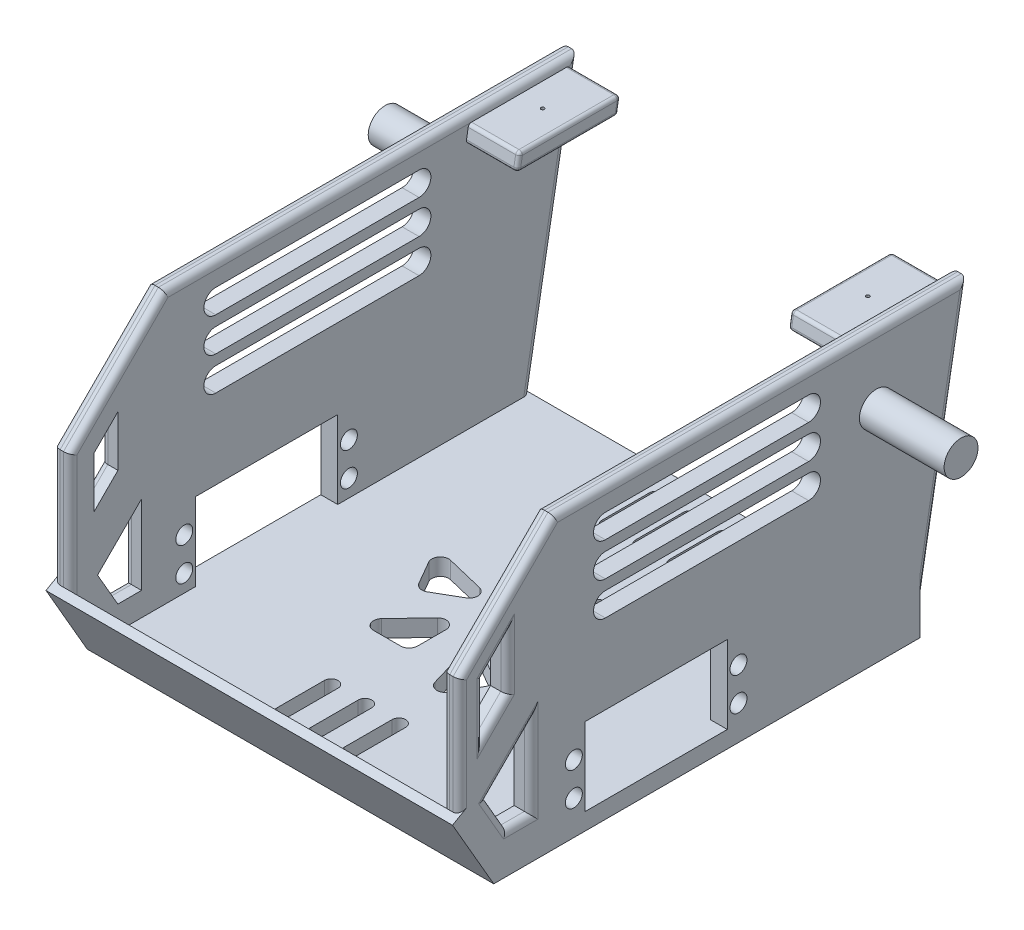
from build123d import *

# Parameters (mm, degrees)
SKETCH6_W           = 120
SKETCH6_H           = 125.893841544
BOSS_EXTRUDE1_DEPTH = 5
BOSS_EXTRUDE2_START = 60
BOSS_EXTRUDE2_DEPTH = 5
BOSS_EXTRUDE3_START = -55
BOSS_EXTRUDE3_DEPTH = 5
SKETCH9_W           = 120
SKETCH9_H           = 24.330127019
BOSS_EXTRUDE5_DEPTH = 2.5
CUT_EXTRUDE1_REACH  = 165.515
SKETCH10_R          = 2.5
SKETCH10_W          = 42
SKETCH10_H          = 20
SKETCH10_H_2        = 3
FILLET1_R           = 2
SKETCH11_R          = 5
BOSS_EXTRUDE6_DEPTH = 25
BOSS_EXTRUDE7_START = -145
SKETCH11_3_R        = 5
BOSS_EXTRUDE7_DEPTH = 25
BOSS_EXTRUDE8_DEPTH = 15
BOSS_EXTRUDE9_START = 110
BOSS_EXTRUDE9_DEPTH = 15
FILLET3_R           = 1
FILLET4_R           = 1
SKETCH13_R          = 0.5
CUT_EXTRUDE2_DEPTH  = 10


with BuildPart() as part:
    # Sketch6 → Boss-Extrude1 (new body)
    with BuildSketch(Plane(origin=(0, 0, 0), x_dir=(1, 0, 0), z_dir=(0, 1, 0))):
        Rectangle(SKETCH6_W, SKETCH6_H)
        with BuildLine():
            Line((7.031840361, 18.39292277), (7.031840361, 10))
            ThreePointArc((7.031840361, 10), (8.602875139, 7.679003745), (11.341459254, 8.275100159))
            Line((11.341459254, 8.275100159), (19.341459254, 16.668022929))
            ThreePointArc((19.341459254, 16.668022929), (19.82991016, 19.377237353), (17.531840361, 20.89292277))
            Line((17.531840361, 20.89292277), (9.531840361, 20.89292277))
            ThreePointArc((9.531840361, 20.89292277), (7.764073408, 20.160689723), (7.031840361, 18.39292277))
        make_face(mode=Mode.SUBTRACT)
        with BuildLine():
            Line((22.859722058, 2.191645487), (26.859722058, -4.736557743))
            ThreePointArc((26.859722058, -4.736557743), (26.696134883, -7.484587277), (24.105660914, -8.416183596))
            Line((24.105660914, -8.416183596), (12.837176584, -5.684441751))
            ThreePointArc((12.837176584, -5.684441751), (10.951649888, -3.610806544), (12.176174218, -1.089752388))
            Line((12.176174218, -1.089752388), (19.444658549, 3.106708997))
            ThreePointArc((19.444658549, 3.106708997), (21.341706161, 3.356460053), (22.859722058, 2.191645487))
        make_face(mode=Mode.SUBTRACT)
        with BuildLine():
            Line((13.327881697, -18.701277282), (9.327881697, -25.629480512))
            ThreePointArc((9.327881697, -25.629480512), (6.866224723, -26.86182463), (4.76420166, -25.084206525))
            Line((4.76420166, -25.084206525), (1.49571733, -13.95954191))
            ThreePointArc((1.49571733, -13.95954191), (2.348774749, -11.289810288), (5.144333857, -11.089752388))
            Line((5.144333857, -11.089752388), (12.412818188, -15.286213773))
            ThreePointArc((12.412818188, -15.286213773), (13.577632754, -16.804229669), (13.327881697, -18.701277282))
        make_face(mode=Mode.SUBTRACT)
        with BuildLine():
            Line((-9.531840361, -20.89292277), (-17.531840361, -20.89292277))
            ThreePointArc((-17.531840361, -20.89292277), (-19.82991016, -19.377237353), (-19.341459254, -16.668022929))
            Line((-19.341459254, -16.668022929), (-11.341459254, -8.275100159))
            ThreePointArc((-11.341459254, -8.275100159), (-8.602875139, -7.679003745), (-7.031840361, -10))
            Line((-7.031840361, -10), (-7.031840361, -18.39292277))
            ThreePointArc((-7.031840361, -18.39292277), (-7.764073408, -20.160689723), (-9.531840361, -20.89292277))
        make_face(mode=Mode.SUBTRACT)
        with BuildLine():
            Line((-22.859722058, -2.191645487), (-26.859722058, 4.736557743))
            ThreePointArc((-26.859722058, 4.736557743), (-26.696134883, 7.484587277), (-24.105660914, 8.416183596))
            Line((-24.105660914, 8.416183596), (-12.837176584, 5.684441751))
            ThreePointArc((-12.837176584, 5.684441751), (-10.951649888, 3.610806544), (-12.176174218, 1.089752388))
            Line((-12.176174218, 1.089752388), (-19.444658549, -3.106708997))
            ThreePointArc((-19.444658549, -3.106708997), (-21.341706161, -3.356460053), (-22.859722058, -2.191645487))
        make_face(mode=Mode.SUBTRACT)
        with BuildLine():
            Line((-13.327881697, 18.701277282), (-9.327881697, 25.629480512))
            ThreePointArc((-9.327881697, 25.629480512), (-6.866224723, 26.86182463), (-4.76420166, 25.084206525))
            Line((-4.76420166, 25.084206525), (-1.49571733, 13.95954191))
            ThreePointArc((-1.49571733, 13.95954191), (-2.348774749, 11.289810288), (-5.144333857, 11.089752388))
            Line((-5.144333857, 11.089752388), (-12.412818188, 15.286213773))
            ThreePointArc((-12.412818188, 15.286213773), (-13.577632754, 16.804229669), (-13.327881697, 18.701277282))
        make_face(mode=Mode.SUBTRACT)
        with BuildLine():
            Line((-2, 40.946920772), (-2, 54.946920772))
            ThreePointArc((-2, 54.946920772), (0, 56.946920772), (2, 54.946920772))
            Line((2, 54.946920772), (2, 40.946920772))
            ThreePointArc((2, 40.946920772), (0, 38.946920772), (-2, 40.946920772))
        make_face(mode=Mode.SUBTRACT)
        with BuildLine():
            Line((12, 40.946920772), (12, 54.946920772))
            ThreePointArc((12, 54.946920772), (10, 56.946920772), (8, 54.946920772))
            Line((8, 54.946920772), (8, 40.946920772))
            ThreePointArc((8, 40.946920772), (10, 38.946920772), (12, 40.946920772))
        make_face(mode=Mode.SUBTRACT)
        with BuildLine():
            Line((-12, 40.946920772), (-12, 54.946920772))
            ThreePointArc((-12, 54.946920772), (-10, 56.946920772), (-8, 54.946920772))
            Line((-8, 54.946920772), (-8, 40.946920772))
            ThreePointArc((-8, 40.946920772), (-10, 38.946920772), (-12, 40.946920772))
        make_face(mode=Mode.SUBTRACT)
        with BuildLine():
            Line((-2, -40.946920772), (-2, -54.946920772))
            ThreePointArc((-2, -54.946920772), (0, -56.946920772), (2, -54.946920772))
            Line((2, -54.946920772), (2, -40.946920772))
            ThreePointArc((2, -40.946920772), (0, -38.946920772), (-2, -40.946920772))
        make_face(mode=Mode.SUBTRACT)
        with BuildLine():
            Line((8, -40.946920772), (8, -54.946920772))
            ThreePointArc((8, -54.946920772), (10, -56.946920772), (12, -54.946920772))
            Line((12, -54.946920772), (12, -40.946920772))
            ThreePointArc((12, -40.946920772), (10, -38.946920772), (8, -40.946920772))
        make_face(mode=Mode.SUBTRACT)
        with BuildLine():
            Line((-12, -40.946920772), (-12, -54.946920772))
            ThreePointArc((-12, -54.946920772), (-10, -56.946920772), (-8, -54.946920772))
            Line((-8, -54.946920772), (-8, -40.946920772))
            ThreePointArc((-8, -40.946920772), (-10, -38.946920772), (-12, -40.946920772))
        make_face(mode=Mode.SUBTRACT)
    extrude(amount=-BOSS_EXTRUDE1_DEPTH)

    # Sketch1 → Boss-Extrude2 (add)
    with BuildSketch(Plane(origin=(0, 0, 0), x_dir=(0, 0, -1), z_dir=(1, 0, 0)).offset(BOSS_EXTRUDE2_START)):
        Polygon((-72.946920772, 52), (-44.946920772, 80), (77.053079228, 80), (62.946920772, 0), (-62.946920772, 0), (-72.946920772, 17.320508076), align=None)
        with BuildLine():
            Line((30, 66.5), (-30, 66.5))
            ThreePointArc((-30, 66.5), (-33.5, 70), (-30, 73.5))
            Line((-30, 73.5), (30, 73.5))
            ThreePointArc((30, 73.5), (33.5, 70), (30, 66.5))
        make_face(mode=Mode.SUBTRACT)
        with BuildLine():
            Line((30, 56.5), (-30, 56.5))
            ThreePointArc((-30, 56.5), (-33.5, 60), (-30, 63.5))
            Line((-30, 63.5), (30, 63.5))
            ThreePointArc((30, 63.5), (33.5, 60), (30, 56.5))
        make_face(mode=Mode.SUBTRACT)
        with BuildLine():
            Line((30, 46.5), (-30, 46.5))
            ThreePointArc((-30, 46.5), (-33.5, 50), (-30, 53.5))
            Line((-30, 53.5), (30, 53.5))
            ThreePointArc((30, 53.5), (33.5, 50), (30, 46.5))
        make_face(mode=Mode.SUBTRACT)
        Polygon((-58.87585296, 56.171572875), (-65.946920772, 49.100505063), (-65.946920772, 34.100505063), (-58.87585296, 41.171572875), align=None, mode=Mode.SUBTRACT)
        Polygon((-64.905468887, 17.392304845), (-58.905468887, 7), (-51.905468887, 7), (-51.905468887, 30.392304845), align=None, mode=Mode.SUBTRACT)
    extrude(amount=-BOSS_EXTRUDE2_DEPTH)

    # Sketch1<2> → Boss-Extrude3 (add)
    with BuildSketch(Plane(origin=(0, 0, 0), x_dir=(0, 0, -1), z_dir=(1, 0, 0)).offset(BOSS_EXTRUDE3_START)):
        Polygon((-72.946920772, 52), (-44.946920772, 80), (77.053079228, 80), (62.946920772, 0), (-62.946920772, 0), (-72.946920772, 17.320508076), align=None)
        with BuildLine():
            Line((30, 66.5), (-30, 66.5))
            ThreePointArc((-30, 66.5), (-33.5, 70), (-30, 73.5))
            Line((-30, 73.5), (30, 73.5))
            ThreePointArc((30, 73.5), (33.5, 70), (30, 66.5))
        make_face(mode=Mode.SUBTRACT)
        with BuildLine():
            Line((30, 56.5), (-30, 56.5))
            ThreePointArc((-30, 56.5), (-33.5, 60), (-30, 63.5))
            Line((-30, 63.5), (30, 63.5))
            ThreePointArc((30, 63.5), (33.5, 60), (30, 56.5))
        make_face(mode=Mode.SUBTRACT)
        with BuildLine():
            Line((30, 46.5), (-30, 46.5))
            ThreePointArc((-30, 46.5), (-33.5, 50), (-30, 53.5))
            Line((-30, 53.5), (30, 53.5))
            ThreePointArc((30, 53.5), (33.5, 50), (30, 46.5))
        make_face(mode=Mode.SUBTRACT)
        Polygon((-58.87585296, 56.171572875), (-65.946920772, 49.100505063), (-65.946920772, 34.100505063), (-58.87585296, 41.171572875), align=None, mode=Mode.SUBTRACT)
        Polygon((-64.905468887, 17.392304845), (-58.905468887, 7), (-51.905468887, 7), (-51.905468887, 30.392304845), align=None, mode=Mode.SUBTRACT)
    extrude(amount=-BOSS_EXTRUDE3_DEPTH)

    # Sketch9 → Boss-Extrude5 (add)
    with BuildSketch(Plane(origin=(0, -27.256816239, 47.210190579), x_dir=(1, 0, 0), z_dir=(0, -0.4999999999999971, 0.8660254037844403))):
        with Locations((0, 39.308396877)):
            Rectangle(SKETCH9_W, SKETCH9_H)
    extrude(amount=BOSS_EXTRUDE5_DEPTH)

    # Cut-Extrude1: up to this face of the body (flat: up to its plane)
    cut_extrude1_end = Plane(part.part.faces().sort_by_distance((60, 34.60628694, -2.836274331))[0])
    # Sketch10 → Cut-Extrude1 (cut, up to the picked face)
    with BuildSketch(Plane.ZY.offset(60), mode=Mode.PRIVATE) as cut_extrude1_sk1:
        with Locations((-9.3, 14.9)):
            Circle(SKETCH10_R)
    cut_extrude1_tool1 = split(extrude(cut_extrude1_sk1.sketch, amount=-CUT_EXTRUDE1_REACH, mode=Mode.PRIVATE), bisect_by=cut_extrude1_end, keep=Keep.BOTH, mode=Mode.PRIVATE)
    # Sketch10 → Cut-Extrude1 (cut, up to the picked face)
    with BuildSketch(Plane.ZY.offset(60), mode=Mode.PRIVATE) as cut_extrude1_sk2:
        with Locations((-9.3, 5.1)):
            Circle(SKETCH10_R)
    cut_extrude1_tool2 = split(extrude(cut_extrude1_sk2.sketch, amount=-CUT_EXTRUDE1_REACH, mode=Mode.PRIVATE), bisect_by=cut_extrude1_end, keep=Keep.BOTH, mode=Mode.PRIVATE)
    # Sketch10 → Cut-Extrude1 (cut, up to the picked face)
    with BuildSketch(Plane.ZY.offset(60), mode=Mode.PRIVATE) as cut_extrude1_sk3:
        with Locations((15, 10)):
            Rectangle(SKETCH10_W, SKETCH10_H)
    cut_extrude1_tool3 = split(extrude(cut_extrude1_sk3.sketch, amount=-CUT_EXTRUDE1_REACH, mode=Mode.PRIVATE), bisect_by=cut_extrude1_end, keep=Keep.BOTH, mode=Mode.PRIVATE)
    # Sketch10 → Cut-Extrude1 (cut, up to the picked face)
    with BuildSketch(Plane.ZY.offset(60), mode=Mode.PRIVATE) as cut_extrude1_sk4:
        with Locations((15, 21.5)):
            Rectangle(SKETCH10_W, SKETCH10_H_2)
    cut_extrude1_tool4 = split(extrude(cut_extrude1_sk4.sketch, amount=-CUT_EXTRUDE1_REACH, mode=Mode.PRIVATE), bisect_by=cut_extrude1_end, keep=Keep.BOTH, mode=Mode.PRIVATE)
    # Sketch10 → Cut-Extrude1 (cut, up to the picked face)
    with BuildSketch(Plane.ZY.offset(60), mode=Mode.PRIVATE) as cut_extrude1_sk5:
        with Locations((39.3, 14.9)):
            Circle(SKETCH10_R)
    cut_extrude1_tool5 = split(extrude(cut_extrude1_sk5.sketch, amount=-CUT_EXTRUDE1_REACH, mode=Mode.PRIVATE), bisect_by=cut_extrude1_end, keep=Keep.BOTH, mode=Mode.PRIVATE)
    # Sketch10 → Cut-Extrude1 (cut, up to the picked face)
    with BuildSketch(Plane.ZY.offset(60), mode=Mode.PRIVATE) as cut_extrude1_sk6:
        with Locations((39.3, 5.1)):
            Circle(SKETCH10_R)
    cut_extrude1_tool6 = split(extrude(cut_extrude1_sk6.sketch, amount=-CUT_EXTRUDE1_REACH, mode=Mode.PRIVATE), bisect_by=cut_extrude1_end, keep=Keep.BOTH, mode=Mode.PRIVATE)
    add(cut_extrude1_tool1.solids().sort_by(Axis((-60, 14.9, -9.3), (1, 0, 0)))[0], mode=Mode.SUBTRACT)
    add(cut_extrude1_tool2.solids().sort_by(Axis((-60, 5.1, -9.3), (1, 0, 0)))[0], mode=Mode.SUBTRACT)
    add(cut_extrude1_tool3.solids().sort_by(Axis((-60, 10, 15), (1, 0, 0)))[0], mode=Mode.SUBTRACT)
    add(cut_extrude1_tool4.solids().sort_by(Axis((-60, 21.5, 15), (1, 0, 0)))[0], mode=Mode.SUBTRACT)
    add(cut_extrude1_tool5.solids().sort_by(Axis((-60, 14.9, 39.3), (1, 0, 0)))[0], mode=Mode.SUBTRACT)
    add(cut_extrude1_tool6.solids().sort_by(Axis((-60, 5.1, 39.3), (1, 0, 0)))[0], mode=Mode.SUBTRACT)

    # Fillet1
    fillet1_edges = [part.edges().sort_by_distance(p)[0] for p in [
        (55, 34.660254038, 72.946920772),
        (55, 66, 58.946920772),
        (55, 80, -16.053079228),
        (55, 40, -70),
        (60, 12.196152423, 61.905468887),
        (60, 23.892304845, 58.405468887),
        (60, 18.696152423, 51.905468887),
        (60, 7, 55.405468887),
        (60, 48.671572875, 58.87585296),
        (60, 37.636038969, 62.411386866),
        (60, 41.600505063, 65.946920772),
        (60, 52.636038969, 62.411386866),
        (60, 34.660254038, 72.946920772),
        (60, 66, 58.946920772),
        (60, 80, -16.053079228),
        (60, 40, -70),
        (-55, 34.660254038, 72.946920772),
        (-55, 40, -70),
        (-55, 80, -16.053079228),
        (-55, 66, 58.946920772),
        (-60, 34.660254038, 72.946920772),
        (-60, 66, 58.946920772),
        (-60, 80, -16.053079228),
        (-60, 40, -70),
        (-60, 12.196152423, 61.905468887),
        (-60, 7, 55.405468887),
        (-60, 18.696152423, 51.905468887),
        (-60, 23.892304845, 58.405468887),
        (-60, 48.671572875, 58.87585296),
        (-60, 52.636038969, 62.411386866),
        (-60, 41.600505063, 65.946920772),
        (-60, 37.636038969, 62.411386866),
    ]]
    fillet(fillet1_edges, radius=FILLET1_R)

    # Sketch11 → Boss-Extrude6 (add)
    with BuildSketch(Plane(origin=(60, 0, 0), x_dir=(0, 0, -1), z_dir=(1, 0, 0))):
        with Locations((50, 60)):
            Circle(SKETCH11_R)
    extrude(amount=BOSS_EXTRUDE6_DEPTH)

    # Sketch11<3> → Boss-Extrude7 (add)
    with BuildSketch(Plane(origin=(60, 0, 0), x_dir=(0, 0, -1), z_dir=(1, 0, 0)).offset(BOSS_EXTRUDE7_START)):
        with Locations((50, 60)):
            Circle(SKETCH11_3_R)
    extrude(amount=BOSS_EXTRUDE7_DEPTH)

    # Sketch12 → Boss-Extrude8 (add)
    with BuildSketch(Plane(origin=(-55, 0, 0), x_dir=(0, 0, -1), z_dir=(1, 0, 0))):
        Polygon((74.669572043, 78), (44.669572043, 78), (43.801331155, 73.075961235), (73.801331155, 73.075961235), align=None)
    extrude(amount=BOSS_EXTRUDE8_DEPTH)

    # Sketch12<2> → Boss-Extrude9 (add)
    with BuildSketch(Plane(origin=(-55, 0, 0), x_dir=(0, 0, -1), z_dir=(1, 0, 0)).offset(BOSS_EXTRUDE9_START)):
        Polygon((74.669572043, 78), (44.669572043, 78), (43.801331155, 73.075961235), (73.801331155, 73.075961235), align=None)
    extrude(amount=-BOSS_EXTRUDE9_DEPTH)

    # Fillet3
    # the kernel refuses this fillet: 1 mm, written as the material it takes off along each edge
    with BuildSketch(Plane(origin=(41, 74.075961235, -44.993084747), x_dir=(0, -1, 0), z_dir=(-1, 0, 0))) as fillet3_piece_1_section:
        Polygon((0, 0), (FILLET3_R * 1.02, 0), (FILLET3_R * 1.02, FILLET3_R * 1.21558866445), (-FILLET3_R * 0.17712114122, FILLET3_R * 1.00450390807), align=None)
    fillet3_piece_1 = extrude(amount=FILLET3_R * 1.02, mode=Mode.PRIVATE)
    fillet3_piece_1 = fillet3_piece_1 - Plane(origin=(41, 74.075961235, -44.993084747), x_dir=(0, 0.6427876096865395, -0.7660444431189778), z_dir=(-1, 0, 0)) * Sphere(FILLET3_R, mode=Mode.PRIVATE)
    add(fillet3_piece_1, mode=Mode.SUBTRACT)
    with BuildSketch(Plane(origin=(41, 74.075961235, -72.962231524), x_dir=(0, -1, 0), z_dir=(-1, 0, 0))) as fillet3_piece_2_section:
        Polygon((0, 0), (FILLET3_R * 1.02, 0), (FILLET3_R * 1.02, -FILLET3_R * 0.855881623801), (FILLET3_R * 0.17712114122, -FILLET3_R * 1.00450390807), align=None)
    fillet3_piece_2 = extrude(amount=FILLET3_R * 1.02, mode=Mode.PRIVATE)
    fillet3_piece_2 = fillet3_piece_2 - Plane(origin=(41, 74.075961235, -72.962231524), x_dir=(0, 0.766044443118978, 0.6427876096865394), z_dir=(-1, 0, 0)) * Sphere(FILLET3_R, mode=Mode.PRIVATE)
    add(fillet3_piece_2, mode=Mode.SUBTRACT)
    with BuildSketch(Plane(origin=(41, 77, -45.508671674), x_dir=(0, 0.17364817766693028, 0.9848077530122081), z_dir=(-1, 0, 0))) as fillet3_piece_3_section:
        Polygon((0, 0), (FILLET3_R * 1.02, 0), (FILLET3_R * 1.02, FILLET3_R * 0.855881623801), (FILLET3_R * 0.17712114122, FILLET3_R * 1.00450390807), align=None)
    fillet3_piece_3 = extrude(amount=FILLET3_R * 1.02, mode=Mode.PRIVATE)
    fillet3_piece_3 = fillet3_piece_3 - Plane(origin=(41, 77, -45.508671674), x_dir=(0, -0.766044443118978, -0.6427876096865394), z_dir=(-1, 0, 0)) * Sphere(FILLET3_R, mode=Mode.PRIVATE)
    add(fillet3_piece_3, mode=Mode.SUBTRACT)
    with BuildSketch(Plane(origin=(41, 77, -73.477818451), x_dir=(0, -0.17364817766693075, -0.984807753012208), z_dir=(-1, 0, 0))) as fillet3_piece_4_section:
        Polygon((0, 0), (FILLET3_R * 1.02, 0), (FILLET3_R * 1.02, -FILLET3_R * 1.21558866445), (-FILLET3_R * 0.17712114122, -FILLET3_R * 1.00450390807), align=None)
    fillet3_piece_4 = extrude(amount=FILLET3_R * 1.02, mode=Mode.PRIVATE)
    fillet3_piece_4 = fillet3_piece_4 - Plane(origin=(41, 77, -73.477818451), x_dir=(0, -0.6427876096865393, 0.7660444431189782), z_dir=(-1, 0, 0)) * Sphere(FILLET3_R, mode=Mode.PRIVATE)
    add(fillet3_piece_4, mode=Mode.SUBTRACT)
    with BuildSketch(Plane(origin=(40, 73.075961235, -44.993084747), x_dir=(1, 0, 0), z_dir=(0, 0, -1)), Plane(origin=(40, 78, -73.477818451), x_dir=(1, 0, 0), z_dir=(0, 0, 1))) as fillet3_piece_5:
        with BuildLine():
            CenterArc((FILLET3_R, -FILLET3_R), FILLET3_R, 90, 90)
            Line((0, -FILLET3_R), (0, 0))
            Line((0, 0), (FILLET3_R, 0))
        make_face()
    extrude(amount=27.969146776, mode=Mode.SUBTRACT)
    with BuildSketch(Plane(origin=(55, 73.075961235, -73.801331155), x_dir=(0, 0.9848077530122079, -0.17364817766693186), z_dir=(-1, 0, 0)), Plane(origin=(55, 78, -44.669572043), x_dir=(0, -0.9848077530122079, 0.17364817766693186), z_dir=(-1, 0, 0))) as fillet3_piece_6:
        with BuildLine():
            CenterArc((FILLET3_R * 0.839099631177, -FILLET3_R), FILLET3_R, 90, 80)
            Line((-FILLET3_R * 0.145708121835, -FILLET3_R * 0.826351822333), (0, 0))
            Line((0, 0), (FILLET3_R * 0.839099631177, 0))
        make_face()
    extrude(amount=14, mode=Mode.SUBTRACT)
    with BuildSketch(Plane(origin=(40, 77.173648178, -44.523863921), x_dir=(1, 0, 0), z_dir=(0, -0.9848077530122081, 0.17364817766693028)), Plane(origin=(40, 73.902313057, -73.947039277), x_dir=(1, 0, 0), z_dir=(0, 0.984807753012208, -0.17364817766693075))) as fillet3_piece_7:
        with BuildLine():
            CenterArc((FILLET3_R, -FILLET3_R), FILLET3_R, 90, 90)
            Line((0, -FILLET3_R), (0, 0))
            Line((0, 0), (FILLET3_R, 0))
        make_face()
    extrude(amount=2.969146776, mode=Mode.SUBTRACT)
    with BuildSketch(Plane(origin=(55, 73.075961235, -43.801331155), x_dir=(0, 0, -1), z_dir=(-1, 0, 0))) as fillet3_piece_8:
        with BuildLine():
            CenterArc((FILLET3_R * 1.19175359259, -FILLET3_R), FILLET3_R, 90, 100)
            Line((FILLET3_R * 0.206945839582, -FILLET3_R * 1.17364817767), (0, 0))
            Line((0, 0), (FILLET3_R * 1.19175359259, 0))
        make_face()
    extrude(amount=14, mode=Mode.SUBTRACT)
    with BuildSketch(Plane(origin=(57.979383981, 78, -74.669572043), x_dir=(0, -0.984807753012208, 0.17364817766693033), z_dir=(-1, 0, 0))) as fillet3_piece_9_section:
        with BuildLine():
            CenterArc((FILLET3_R * 1.19175359259, FILLET3_R), FILLET3_R, 170, 100)
            Line((FILLET3_R * 0.206945839582, FILLET3_R * 1.17364817767), (0, 0))
            Line((0, 0), (FILLET3_R * 1.19175359259, 0))
        make_face()
    fillet3_piece_9 = extrude(amount=16.979383981, mode=Mode.PRIVATE)
    fillet3_piece_9 = fillet3_piece_9 - Plane(origin=(57, 77.683773132, -74.613812714), x_dir=(-1, 0, 0), z_dir=(0, -0.9848077530122081, 0.17364817766693014)) * Cylinder(2, 39, mode=Mode.PRIVATE)
    fillet3_piece_9 = fillet3_piece_9 - Plane(origin=(57, 78, -74.348466866), x_dir=(-1, 0, 0), z_dir=(0, 0, -1)) * Cylinder(2, 39, mode=Mode.PRIVATE)
    add(fillet3_piece_9, mode=Mode.SUBTRACT)

    # Fillet4
    # the kernel refuses this fillet: 1 mm, written as the material it takes off along each edge
    with BuildSketch(Plane(origin=(-41, 74.075961235, -72.962231524), x_dir=(0, -1, 0), z_dir=(1, 0, 0))) as fillet4_piece_1_section:
        Polygon((0, 0), (FILLET4_R * 1.02, 0), (FILLET4_R * 1.02, FILLET4_R * 0.855881623801), (FILLET4_R * 0.17712114122, FILLET4_R * 1.00450390807), align=None)
    fillet4_piece_1 = extrude(amount=FILLET4_R * 1.02, mode=Mode.PRIVATE)
    fillet4_piece_1 = fillet4_piece_1 - Plane(origin=(-41, 74.075961235, -72.962231524), x_dir=(0, 0.766044443118978, 0.6427876096865394), z_dir=(1, 0, 0)) * Sphere(FILLET4_R, mode=Mode.PRIVATE)
    add(fillet4_piece_1, mode=Mode.SUBTRACT)
    with BuildSketch(Plane(origin=(-41, 77, -73.477818451), x_dir=(0, -0.17364817766693075, -0.984807753012208), z_dir=(1, 0, 0))) as fillet4_piece_2_section:
        Polygon((0, 0), (FILLET4_R * 1.02, 0), (FILLET4_R * 1.02, FILLET4_R * 1.21558866445), (-FILLET4_R * 0.17712114122, FILLET4_R * 1.00450390807), align=None)
    fillet4_piece_2 = extrude(amount=FILLET4_R * 1.02, mode=Mode.PRIVATE)
    fillet4_piece_2 = fillet4_piece_2 - Plane(origin=(-41, 77, -73.477818451), x_dir=(0, -0.6427876096865393, 0.7660444431189782), z_dir=(1, 0, 0)) * Sphere(FILLET4_R, mode=Mode.PRIVATE)
    add(fillet4_piece_2, mode=Mode.SUBTRACT)
    with BuildSketch(Plane(origin=(-41, 77, -45.508671674), x_dir=(0, 0.17364817766693028, 0.9848077530122081), z_dir=(1, 0, 0))) as fillet4_piece_3_section:
        Polygon((0, 0), (FILLET4_R * 1.02, 0), (FILLET4_R * 1.02, -FILLET4_R * 0.855881623801), (FILLET4_R * 0.17712114122, -FILLET4_R * 1.00450390807), align=None)
    fillet4_piece_3 = extrude(amount=FILLET4_R * 1.02, mode=Mode.PRIVATE)
    fillet4_piece_3 = fillet4_piece_3 - Plane(origin=(-41, 77, -45.508671674), x_dir=(0, -0.766044443118978, -0.6427876096865394), z_dir=(1, 0, 0)) * Sphere(FILLET4_R, mode=Mode.PRIVATE)
    add(fillet4_piece_3, mode=Mode.SUBTRACT)
    with BuildSketch(Plane(origin=(-41, 74.075961235, -44.993084747), x_dir=(0, -1, 0), z_dir=(1, 0, 0))) as fillet4_piece_4_section:
        Polygon((0, 0), (FILLET4_R * 1.02, 0), (FILLET4_R * 1.02, -FILLET4_R * 1.21558866445), (-FILLET4_R * 0.17712114122, -FILLET4_R * 1.00450390807), align=None)
    fillet4_piece_4 = extrude(amount=FILLET4_R * 1.02, mode=Mode.PRIVATE)
    fillet4_piece_4 = fillet4_piece_4 - Plane(origin=(-41, 74.075961235, -44.993084747), x_dir=(0, 0.6427876096865395, -0.7660444431189778), z_dir=(1, 0, 0)) * Sphere(FILLET4_R, mode=Mode.PRIVATE)
    add(fillet4_piece_4, mode=Mode.SUBTRACT)
    with BuildSketch(Plane(origin=(-55, 73.075961235, -73.801331155), x_dir=(0, 0, 1), z_dir=(1, 0, 0))) as fillet4_piece_5:
        with BuildLine():
            CenterArc((FILLET4_R * 0.839099631177, -FILLET4_R), FILLET4_R, 90, 80)
            Line((-FILLET4_R * 0.145708121835, -FILLET4_R * 0.826351822333), (0, 0))
            Line((0, 0), (FILLET4_R * 0.839099631177, 0))
        make_face()
    extrude(amount=14, mode=Mode.SUBTRACT)
    with BuildSketch(Plane(origin=(-57.979383981, 78, -74.669572043), x_dir=(0, -0.984807753012208, 0.17364817766693033), z_dir=(1, 0, 0))) as fillet4_piece_6_section:
        with BuildLine():
            CenterArc((FILLET4_R * 1.19175359259, -FILLET4_R), FILLET4_R, 90, 100)
            Line((FILLET4_R * 0.206945839582, -FILLET4_R * 1.17364817767), (0, 0))
            Line((0, 0), (FILLET4_R * 1.19175359259, 0))
        make_face()
    fillet4_piece_6 = extrude(amount=16.979383981, mode=Mode.PRIVATE)
    fillet4_piece_6 = fillet4_piece_6 - Plane(origin=(-57, 77.683773132, -74.613812714), x_dir=(1, 0, 0), z_dir=(0, -0.9848077530122081, 0.17364817766693014)) * Cylinder(2, 39, mode=Mode.PRIVATE)
    fillet4_piece_6 = fillet4_piece_6 - Plane(origin=(-57, 78, -74.348466866), x_dir=(1, 0, 0), z_dir=(0, 0, -1)) * Cylinder(2, 39, mode=Mode.PRIVATE)
    add(fillet4_piece_6, mode=Mode.SUBTRACT)
    with BuildSketch(Plane(origin=(-55, 78, -44.669572043), x_dir=(0, -0.9848077530122079, 0.17364817766693186), z_dir=(1, 0, 0))) as fillet4_piece_7:
        with BuildLine():
            CenterArc((FILLET4_R * 0.839099631177, FILLET4_R), FILLET4_R, 190, 80)
            Line((-FILLET4_R * 0.145708121835, FILLET4_R * 0.826351822333), (0, 0))
            Line((0, 0), (FILLET4_R * 0.839099631177, 0))
        make_face()
    extrude(amount=14, mode=Mode.SUBTRACT)
    with BuildSketch(Plane(origin=(-55, 73.075961235, -43.801331155), x_dir=(0, 0, -1), z_dir=(1, 0, 0))) as fillet4_piece_8:
        with BuildLine():
            CenterArc((FILLET4_R * 1.19175359259, FILLET4_R), FILLET4_R, 170, 100)
            Line((FILLET4_R * 0.206945839582, FILLET4_R * 1.17364817767), (0, 0))
            Line((0, 0), (FILLET4_R * 1.19175359259, 0))
        make_face()
    extrude(amount=14, mode=Mode.SUBTRACT)
    with BuildSketch(Plane(origin=(-40, 73.902313057, -73.947039277), x_dir=(-1, 0, 0), z_dir=(0, 0.984807753012208, -0.17364817766693075)), Plane(origin=(-40, 77.173648178, -44.523863921), x_dir=(-1, 0, 0), z_dir=(0, -0.9848077530122081, 0.17364817766693028))) as fillet4_piece_9:
        with BuildLine():
            CenterArc((FILLET4_R, FILLET4_R), FILLET4_R, 180, 90)
            Line((0, FILLET4_R), (0, 0))
            Line((0, 0), (FILLET4_R, 0))
        make_face()
    extrude(amount=2.969146776, mode=Mode.SUBTRACT)
    with BuildSketch(Plane(origin=(-40, 78, -73.477818451), x_dir=(-1, 0, 0), z_dir=(0, 0, 1)), Plane(origin=(-40, 73.075961235, -44.993084747), x_dir=(-1, 0, 0), z_dir=(0, 0, -1))) as fillet4_piece_10:
        with BuildLine():
            CenterArc((FILLET4_R, FILLET4_R), FILLET4_R, 180, 90)
            Line((0, FILLET4_R), (0, 0))
            Line((0, 0), (FILLET4_R, 0))
        make_face()
    extrude(amount=27.969146776, mode=Mode.SUBTRACT)

    # Sketch13 → Cut-Extrude2 (cut)
    with BuildSketch(Plane(origin=(0, 78, 0), x_dir=(1, 0, 0), z_dir=(0, 1, 0))):
        with Locations(Location((-48, 59.493245062, 0), (0, 0, 270))):
            Circle(SKETCH13_R)
        with Locations(Location((48, 59.493245062, 0), (0, 0, 270))):
            Circle(SKETCH13_R)
    extrude(amount=-CUT_EXTRUDE2_DEPTH, mode=Mode.SUBTRACT)


solid = part.part
